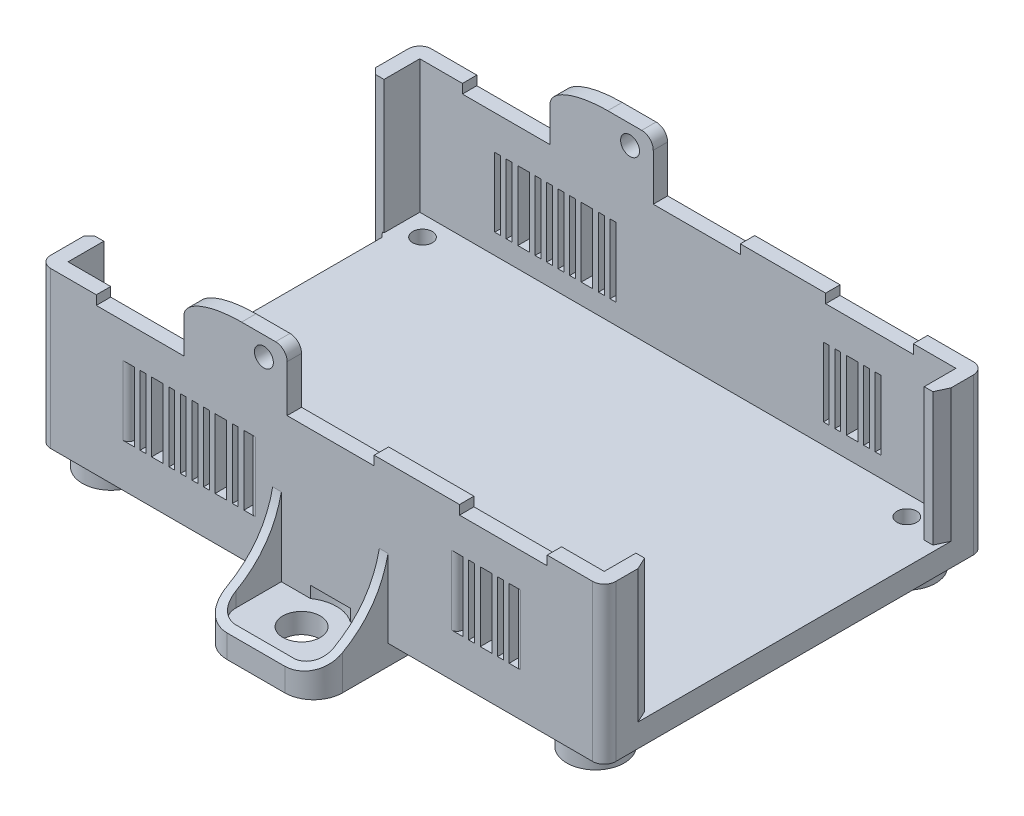
from build123d import *
from OCP.BRepFilletAPI import BRepFilletAPI_MakeChamfer

# Parameters (mm, degrees)
SKETCH1_W            = 94.996
SKETCH1_H            = 66
SKETCH1_R            = 1.7
BOSS_EXTRUDE2_DEPTH  = 4
SKETCH2_R            = 4.995073186
SKETCH2_R_2          = 2.75
BOSS_EXTRUDE3_DEPTH  = 3.5
SKETCH3_W            = 94.996
SKETCH3_H            = 2.5
BOSS_EXTRUDE4_DEPTH  = 23.05
BOSS_EXTRUDE12_DEPTH = 3.5
BOSS_EXTRUDE7_DEPTH  = 3
SKETCH9_W            = 2.5
SKETCH9_H            = 23.05
BOSS_EXTRUDE8_DEPTH  = 6.2
SKETCH10_W           = 2.5
SKETCH10_H           = 23.05
BOSS_EXTRUDE9_DEPTH  = 6.2
BOSS_EXTRUDE10_START = 4
BOSS_EXTRUDE10_DEPTH = 4
CHAMFER1_SIZE        = 1
SKETCH12_W           = 2.5
SKETCH12_H           = 5.5
BOSS_EXTRUDE11_DEPTH = 23.05
CHAMFER2_SIZE        = 1
CHAMFER2_SIZE2       = 2.144506921
SKETCH13_W           = 1
SKETCH13_H           = 12
SKETCH13_W_2         = 2
CUT_EXTRUDE2_DEPTH   = 96.491939471
CUT_EXTRUDE5_REACH   = 99.504
SKETCH20_W           = 15.1
SKETCH20_H           = 1.6
SKETCH20_W_2         = 15.2
FILLET1_R            = 2
FILLET2_R            = 1
FILLET3_R            = 5
BOSS_EXTRUDE13_DEPTH = 13.5
CUT_EXTRUDE6_DEPTH   = 20
CUT_EXTRUDE7_REACH   = 75.407
SKETCH24_R           = 3.25
SKETCH25_R           = 6.075
CUT_EXTRUDE8_DEPTH   = 2
SKETCH26_W           = 17.896
SKETCH26_H           = 2.5
BOSS_EXTRUDE15_DEPTH = 8.5
CUT_EXTRUDE9_REACH   = 102.195
SKETCH28_R           = 1.6375
FILLET5_SIZE         = 10
FILLET5_SIZE_2       = 4
FILLET6_R            = 2
MIRROR9_START        = -33
MIRROR9_OUTLINE_R    = 1.6375
MIRROR9_DEPTH        = 2.5


# Read off the part's stored shape, not the designer's step: Mirror9
with BuildPart() as part:
    # Sketch1 → Boss-Extrude2 (new body)
    with BuildSketch(Plane(origin=(0, 0, 0), x_dir=(1, 0, 0), z_dir=(0, 1, 0))):
        Rectangle(SKETCH1_W, SKETCH1_H)
        with Locations(Location((-44.02, 27, 0), (0, 0, 270))):
            Circle(SKETCH1_R, mode=Mode.SUBTRACT)
        with Locations(Location((-44.02, -27, 0), (0, 0, 270))):
            Circle(SKETCH1_R, mode=Mode.SUBTRACT)
        with Locations(Location((39.98, 27, 0), (0, 0, 270))):
            Circle(SKETCH1_R, mode=Mode.SUBTRACT)
        with Locations(Location((39.98, -27, 0), (0, 0, 270))):
            Circle(SKETCH1_R, mode=Mode.SUBTRACT)
    extrude(amount=BOSS_EXTRUDE2_DEPTH)

    # Sketch2 → Boss-Extrude3 (add)
    # profile 1 of 4: a face of its own
    with BuildSketch(Plane(origin=(0, 0, 0), x_dir=(-1, 0, 0), z_dir=(0, -1, 0))):
        with Locations(Location((44.02, 27, 0), (0, 0, 314.129791109))):
            Circle(SKETCH2_R)
        with Locations(Location((44.02, 27, 0), (0, 0, 90))):
            Circle(SKETCH2_R_2, mode=Mode.SUBTRACT)
    # profile 2 of 4: a face of its own
    with BuildSketch(Plane(origin=(0, 0, 0), x_dir=(-1, 0, 0), z_dir=(0, -1, 0))):
        with Locations(Location((44.02, -27, 0), (0, 0, 314.129791109))):
            Circle(SKETCH2_R)
        with Locations(Location((44.02, -27, 0), (0, 0, 90))):
            Circle(SKETCH2_R_2, mode=Mode.SUBTRACT)
    # profile 3 of 4: a face of its own
    with BuildSketch(Plane(origin=(0, 0, 0), x_dir=(-1, 0, 0), z_dir=(0, -1, 0))):
        with Locations(Location((-39.98, -27, 0), (0, 0, 270))):
            Circle(SKETCH2_R)
        with Locations(Location((-39.98, -27, 0), (0, 0, 90))):
            Circle(SKETCH2_R_2, mode=Mode.SUBTRACT)
    # profile 4 of 4: a face of its own
    with BuildSketch(Plane(origin=(0, 0, 0), x_dir=(-1, 0, 0), z_dir=(0, -1, 0))):
        with Locations(Location((-39.98, 27, 0), (0, 0, 270))):
            Circle(SKETCH2_R)
        with Locations(Location((-39.98, 27, 0), (0, 0, 90))):
            Circle(SKETCH2_R_2, mode=Mode.SUBTRACT)
    extrude(amount=BOSS_EXTRUDE3_DEPTH)

    # Sketch3 → Boss-Extrude4 (add)
    with BuildSketch(Plane(origin=(0, 4, 0), x_dir=(1, 0, 0), z_dir=(0, 1, 0))):
        with Locations((0, -31.75)):
            Rectangle(SKETCH3_W, SKETCH3_H)
        with Locations((0, 31.75)):
            Rectangle(SKETCH3_W, SKETCH3_H)
    extrude(amount=BOSS_EXTRUDE4_DEPTH)

    # Sketch21 → Boss-Extrude12 (add)
    with BuildSketch(Plane.XZ):
        with BuildLine():
            Line((-39.024926814, 27), (-10, 27))
            Line((-10, 27), (-10, 45.9))
            Line((-10, 45.9), (10, 45.9))
            Line((10, 45.9), (10, 27))
            Line((10, 27), (34.984926814, 27))
            ThreePointArc((34.984926814, 27), (36.447949877, 23.467949877), (39.98, 22.004926814))
            Line((39.98, 22.004926814), (39.98, -22.004926814))
            ThreePointArc((39.98, -22.004926814), (36.447949877, -23.467949877), (34.984926814, -27))
            Line((34.984926814, -27), (10, -27))
            Line((10, -27), (10, -45.9))
            Line((10, -45.9), (-10, -45.9))
            Line((-10, -45.9), (-10, -27))
            Line((-10, -27), (-39.024926814, -27))
            ThreePointArc((-39.024926814, -27), (-40.487949877, -23.467949877), (-44.02, -22.004926814))
            Line((-44.02, -22.004926814), (-44.02, 22.004926814))
            ThreePointArc((-44.02, 22.004926814), (-40.487949877, 23.467949877), (-39.024926814, 27))
        make_face()
    extrude(amount=BOSS_EXTRUDE12_DEPTH)

    # Sketch8 → Boss-Extrude7 (add)
    with BuildSketch(Plane.ZY.offset(47.498)):
        Polygon((24.3, 0), (24.3, 4), (30.5, 4), (30.5, 27.05), (33, 27.05), (33, 0), align=None)
        Polygon((-24.3, 4), (-24.3, 0), (-33, 0), (-33, 27.05), (-30.5, 27.05), (-30.5, 4), align=None)
    extrude(amount=BOSS_EXTRUDE7_DEPTH)

    # Sketch9 → Boss-Extrude8 (add)
    with BuildSketch(Plane.XY.offset(-30.5)):
        with Locations((-49.248, 15.525)):
            Rectangle(SKETCH9_W, SKETCH9_H)
    extrude(amount=BOSS_EXTRUDE8_DEPTH)

    # Sketch10 → Boss-Extrude9 (add)
    with BuildSketch(Plane(origin=(0, 0, 30.5), x_dir=(-1, 0, 0), z_dir=(0, 0, -1))):
        with Locations((49.248, 15.525)):
            Rectangle(SKETCH10_W, SKETCH10_H)
    extrude(amount=BOSS_EXTRUDE9_DEPTH)

    # Sketch11 → Boss-Extrude10 (add)
    with BuildSketch(Plane(origin=(0, 0, 0), x_dir=(1, 0, 0), z_dir=(0, 1, 0)).offset(BOSS_EXTRUDE10_START)):
        with BuildLine():
            Line((-47.498, 24.3), (-48.222470242, 24.3))
            ThreePointArc((-48.222470242, 24.3), (-47.885661443, 23.836549709), (-47.498, 23.414714497))
            Line((-47.498, 23.414714497), (-47.498, 24.3))
        make_face()
        with BuildLine():
            Line((-48.222470242, -24.3), (-47.498, -24.3))
            Line((-47.498, -24.3), (-47.498, -23.414714497))
            ThreePointArc((-47.498, -23.414714497), (-47.885661443, -23.836549709), (-48.222470242, -24.3))
        make_face()
    extrude(amount=-BOSS_EXTRUDE10_DEPTH)

    # Chamfer1
    chamfer1_edges = [part.edges().sort_by_distance(p)[0] for p in [
        (-50.498, 13.525, 24.3),
        (-50.498, 13.525, -24.3),
    ]]
    chamfer(chamfer1_edges, length=CHAMFER1_SIZE)

    # Sketch12 → Boss-Extrude11 (add)
    with BuildSketch(Plane(origin=(0, 4, 0), x_dir=(1, 0, 0), z_dir=(0, 1, 0))):
        with Locations((46.248, -27.75)):
            Rectangle(SKETCH12_W, SKETCH12_H)
        with Locations((46.248, 27.75)):
            Rectangle(SKETCH12_W, SKETCH12_H)
    extrude(amount=BOSS_EXTRUDE11_DEPTH)

    # Chamfer2: one chamfer whose edges measure the first distance from different faces: ONE call of the kernel's chamfer builder (chamfer() names one face for all edges)
    chamfer2_edges_1 = [part.edges().sort_by_distance(p)[0] for p in [
        (47.498, 15.525, 25),
    ]]
    chamfer2_side_1 = [part.faces().sort_by_distance(p)[0] for p in [
        (46.248, 15.525, 25),
    ]]
    chamfer2_edges_2 = [part.edges().sort_by_distance(p)[0] for p in [
        (47.498, 15.525, -25),
    ]]
    chamfer2_side_2 = [part.faces().sort_by_distance(p)[0] for p in [
        (46.248, 15.525, -25),
    ]]
    chamfer2 = BRepFilletAPI_MakeChamfer(part.part.solid().wrapped)
    for e in chamfer2_edges_1:
        chamfer2.Add(CHAMFER2_SIZE, CHAMFER2_SIZE2, e.wrapped, chamfer2_side_1[0].wrapped)  # the first distance lies on this face
    for e in chamfer2_edges_2:
        chamfer2.Add(CHAMFER2_SIZE, CHAMFER2_SIZE2, e.wrapped, chamfer2_side_2[0].wrapped)  # the first distance lies on this face
    add(Compound.cast(chamfer2.Shape()), mode=Mode.REPLACE)

    # Sketch13 → Cut-Extrude2 (cut, through all)
    with BuildSketch(Plane.XY.offset(-30.5)):
        with Locations((-34.498, 13.5)):
            Rectangle(SKETCH13_W, SKETCH13_H)
        with Locations((-27.498, 13.5)):
            Rectangle(SKETCH13_W, SKETCH13_H)
        with Locations((-29.998, 13.5)):
            Rectangle(SKETCH13_W_2, SKETCH13_H)
        with Locations((-32.498, 13.5)):
            Rectangle(SKETCH13_W, SKETCH13_H)
        with Locations((-25.498, 13.5)):
            Rectangle(SKETCH13_W, SKETCH13_H)
        with Locations((22.498, 13.5)):
            Rectangle(SKETCH13_W, SKETCH13_H)
        with Locations((29.498, 13.5)):
            Rectangle(SKETCH13_W, SKETCH13_H)
        with Locations((26.998, 13.5)):
            Rectangle(SKETCH13_W_2, SKETCH13_H)
        with Locations((24.498, 13.5)):
            Rectangle(SKETCH13_W, SKETCH13_H)
        with Locations((31.498, 13.5)):
            Rectangle(SKETCH13_W, SKETCH13_H)
        with Locations((-23.498, 13.5)):
            Rectangle(SKETCH13_W, SKETCH13_H)
        with Locations((-16.498, 13.5)):
            Rectangle(SKETCH13_W, SKETCH13_H)
        with Locations((-18.998, 13.5)):
            Rectangle(SKETCH13_W_2, SKETCH13_H)
        with Locations((-21.498, 13.5)):
            Rectangle(SKETCH13_W, SKETCH13_H)
        with Locations((-14.498, 13.5)):
            Rectangle(SKETCH13_W, SKETCH13_H)
    cut_extrude2 = extrude(amount=-CUT_EXTRUDE2_DEPTH, mode=Mode.SUBTRACT)

    # Mirror1: Cut-Extrude2 across plane
    add(cut_extrude2.mirror(Plane.XY), mode=Mode.SUBTRACT)

    # Sketch20 → Cut-Extrude5 (cut, up to next)
    with BuildSketch(Plane(origin=(0, 0, -33), x_dir=(-1, 0, 0), z_dir=(0, 0, -1)), mode=Mode.PRIVATE) as cut_extrude5_sk1:
        with Locations((-0.048, 26.25)):
            Rectangle(SKETCH20_W, SKETCH20_H)
    cut_extrude5_tool1 = extrude(cut_extrude5_sk1.sketch, amount=-CUT_EXTRUDE5_REACH, mode=Mode.PRIVATE) & part.part
    # Sketch20 → Cut-Extrude5 (cut, up to next)
    with BuildSketch(Plane(origin=(0, 0, -33), x_dir=(-1, 0, 0), z_dir=(0, 0, -1)), mode=Mode.PRIVATE) as cut_extrude5_sk2:
        with Locations((-29.998, 26.25)):
            Rectangle(SKETCH20_W_2, SKETCH20_H)
    cut_extrude5_tool2 = extrude(cut_extrude5_sk2.sketch, amount=-CUT_EXTRUDE5_REACH, mode=Mode.PRIVATE) & part.part
    # Sketch20 → Cut-Extrude5 (cut, up to next)
    with BuildSketch(Plane(origin=(0, 0, -33), x_dir=(-1, 0, 0), z_dir=(0, 0, -1)), mode=Mode.PRIVATE) as cut_extrude5_sk3:
        with Locations((32.998, 26.25)):
            Rectangle(SKETCH20_W_2, SKETCH20_H)
    cut_extrude5_tool3 = extrude(cut_extrude5_sk3.sketch, amount=-CUT_EXTRUDE5_REACH, mode=Mode.PRIVATE) & part.part
    cut_extrude5_1 = cut_extrude5_tool1.solids().sort_by_distance((0.048, 26.25, -33))[0]
    add(cut_extrude5_1, mode=Mode.SUBTRACT)
    cut_extrude5_2 = cut_extrude5_tool2.solids().sort_by_distance((29.998, 26.25, -33))[0]
    add(cut_extrude5_2, mode=Mode.SUBTRACT)
    cut_extrude5_3 = cut_extrude5_tool3.solids().sort_by_distance((-32.998, 26.25, -33))[0]
    add(cut_extrude5_3, mode=Mode.SUBTRACT)
    cut_extrude5 = cut_extrude5_1 + cut_extrude5_2 + cut_extrude5_3  # Cut-Extrude5 as one shape, for the pattern or mirror that repeats it

    # Mirror2: Cut-Extrude5 across plane
    add(cut_extrude5.mirror(Plane.XY), mode=Mode.SUBTRACT)

    # Fillet1
    fillet1_edges = [part.edges().sort_by_distance(p)[0] for p in [
        (-50.498, 13.525, 33),
        (-50.498, 13.525, -33),
        (47.498, 13.525, 33),
        (47.498, 13.525, -33),
    ]]
    fillet(fillet1_edges, radius=FILLET1_R)

    # Fillet2
    fillet2_edges = [part.edges().sort_by_distance(p)[0] for p in [
        (21.998, 13.5, -33),
        (-13.998, 13.5, -33),
        (31.998, 13.5, -33),
        (-34.998, 13.5, -33),
        (21.998, 13.5, 33),
        (-13.998, 13.5, 33),
        (31.998, 13.5, 33),
        (-34.998, 13.5, 33),
    ]]
    fillet(fillet2_edges, radius=FILLET2_R)

    # Fillet3
    fillet3_edges = [part.edges().sort_by_distance(p)[0] for p in [
        (10, -1.75, 45.9),
        (-10, -1.75, 45.9),
        (-10, -1.75, -45.9),
        (10, -1.75, -45.9),
    ]]
    fillet(fillet3_edges, radius=FILLET3_R)

    # Sketch22 → Boss-Extrude13 (add)
    with BuildSketch(Plane(origin=(0, 0, 0), x_dir=(1, 0, 0), z_dir=(0, 1, 0))):
        with BuildLine():
            Line((8.5, 33), (8.5, 40.9))
            ThreePointArc((8.5, 40.9), (7.474873734, 43.374873734), (5, 44.4))
            Line((5, 44.4), (-5, 44.4))
            ThreePointArc((-5, 44.4), (-7.474873734, 43.374873734), (-8.5, 40.9))
            Line((-8.5, 40.9), (-8.5, 33))
            Line((-8.5, 33), (-10, 33))
            Line((-10, 33), (-10, 40.9))
            ThreePointArc((-10, 40.9), (-8.535533906, 44.435533906), (-5, 45.9))
            Line((-5, 45.9), (5, 45.9))
            ThreePointArc((5, 45.9), (8.535533906, 44.435533906), (10, 40.9))
            Line((10, 40.9), (10, 33))
            Line((10, 33), (8.5, 33))
        make_face()
    boss_extrude13 = extrude(amount=BOSS_EXTRUDE13_DEPTH)

    # Sketch23 → Cut-Extrude6 (cut)
    with BuildSketch(Plane.ZY.offset(10)):
        with BuildLine():
            Line((-45.9, 0.5), (-45.9, 13.5))
            Line((-45.9, 13.5), (-33, 13.5))
            add(Edge.make_bspline(
                [(-33, 13.5), (-35.103482807, 3.573386803), (-45.9, 0.5)],
                knots=[0, 0, 0, 1, 1, 1], degree=2))
        make_face()
    cut_extrude6 = extrude(amount=-CUT_EXTRUDE6_DEPTH, mode=Mode.SUBTRACT)

    # Sketch24 → Cut-Extrude7 (cut, up to next)
    with BuildSketch(Plane(origin=(0, 0, 0), x_dir=(1, 0, 0), z_dir=(0, 1, 0)), mode=Mode.PRIVATE) as cut_extrude7_sk1:
        with Locations(Location((0, 38, 0), (0, 0, 270))):
            Circle(SKETCH24_R)
    cut_extrude7_tool1 = extrude(cut_extrude7_sk1.sketch, amount=-CUT_EXTRUDE7_REACH, mode=Mode.PRIVATE) & part.part
    cut_extrude7 = cut_extrude7_tool1.solids().sort_by_distance((0, 0, -38))[0]
    add(cut_extrude7, mode=Mode.SUBTRACT)

    # Mirror7: Boss-Extrude13, Cut-Extrude6, Cut-Extrude7 across plane
    add(boss_extrude13.mirror(Plane.XY))
    add(cut_extrude6.mirror(Plane.XY), mode=Mode.SUBTRACT)
    add(cut_extrude7.mirror(Plane.XY), mode=Mode.SUBTRACT)

    # Sketch25 → Cut-Extrude8 (cut)
    with BuildSketch(Plane(origin=(0, 0, 0), x_dir=(1, 0, 0), z_dir=(0, 1, 0))):
        with Locations((0, -38)):
            Circle(SKETCH25_R)
    cut_extrude8 = extrude(amount=CUT_EXTRUDE8_DEPTH, mode=Mode.SUBTRACT)

    # Mirror8: Cut-Extrude8 across plane
    add(cut_extrude8.mirror(Plane.XY), mode=Mode.SUBTRACT)

    # Sketch26 → Boss-Extrude15 (add)
    with BuildSketch(Plane(origin=(0, 27.05, 0), x_dir=(1, 0, 0), z_dir=(0, 1, 0))):
        with Locations((-16.45, -31.75)):
            Rectangle(SKETCH26_W, SKETCH26_H)
    extrude(amount=BOSS_EXTRUDE15_DEPTH)

    # Sketch28 → Cut-Extrude9 (cut, up to next)
    with BuildSketch(Plane.XY.offset(33), mode=Mode.PRIVATE) as cut_extrude9_sk1:
        with Locations((-11.527819555, 32.2375)):
            Circle(SKETCH28_R)
    cut_extrude9_tool1 = extrude(cut_extrude9_sk1.sketch, amount=-CUT_EXTRUDE9_REACH, mode=Mode.PRIVATE) & part.part
    add(cut_extrude9_tool1.solids().sort_by_distance((-11.52782, 32.2375, 33))[0], mode=Mode.SUBTRACT)

    # Fillet5
    # an asymmetric fillet: 10, 4 mm, written as the material it takes off along each edge
    with BuildSketch(Plane(origin=(-25.398, 35.55, 5.5), x_dir=(1, 0, 0), z_dir=(0, 0, 1))) as fillet5_piece_1:
        with BuildLine():
            Bezier((FILLET5_SIZE, 0), (0, 0), (0, -FILLET5_SIZE_2), weights=[1, 0.707106781, 1])
            Line((0, -FILLET5_SIZE_2), (0, 0))
            Line((0, 0), (FILLET5_SIZE, 0))
        make_face()
    extrude(amount=52.5, mode=Mode.SUBTRACT)

    # Fillet6
    fillet6_edges = [part.edges().sort_by_distance(p)[0] for p in [
        (-7.502, 35.55, 31.75),
    ]]
    fillet(fillet6_edges, radius=FILLET6_R)

    # Mirror9 outline → Mirror9 (add)
    with BuildSketch(Plane.XY.offset(MIRROR9_START)):
        with BuildLine():
            add(Edge.make_bspline(
                [(-25.398, 31.55), (-25.398, 35.55), (-15.398, 35.55)],
                knots=[0, 0, 0, 1, 1, 1], degree=2, weights=[1, 0.707106781, 1]))
            Line((-25.398, 31.55), (-25.398, 27.05))
            Line((-25.398, 27.05), (-7.502, 27.05))
            Line((-7.502, 27.05), (-7.502, 33.55))
            ThreePointArc((-7.502, 33.55), (-8.087786438, 34.964213562), (-9.502, 35.55))
            Line((-9.502, 35.55), (-15.398, 35.55))
        make_face()
        with Locations((-11.527819555, 32.2375)):
            Circle(MIRROR9_OUTLINE_R, mode=Mode.SUBTRACT)
    extrude(amount=MIRROR9_DEPTH)


solid = part.part
